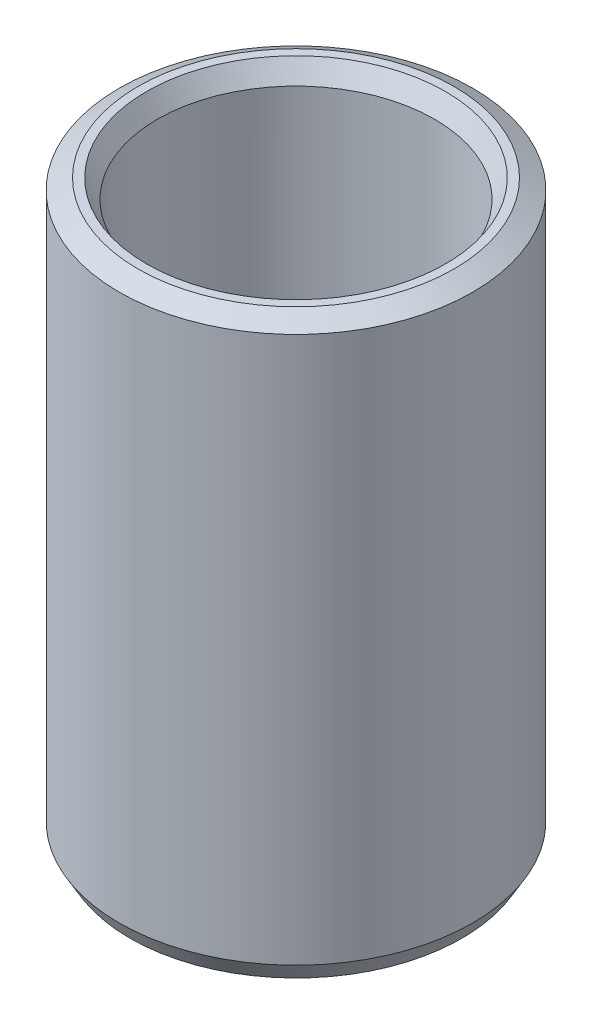
from build123d import *
from OCP.BRepFilletAPI import BRepFilletAPI_MakeChamfer

# Parameters (mm, degrees)
SKETCH1_R           = 45
BOSS_EXTRUDE1_DEPTH = 146.611225133
SKETCH2_R           = 35.304942376
CUT_EXTRUDE1_DEPTH  = 160.827567507
CHAMFER1_SIZE       = 2.74463988
CHAMFER1_SIZE2      = 4.753855721


with BuildPart() as part:
    # Sketch1 → Boss-Extrude1 (new body)
    with BuildSketch(Plane(origin=(0, 0, 0), x_dir=(1, 0, 0), z_dir=(0, 1, 0))):
        Circle(SKETCH1_R)
    extrude(amount=BOSS_EXTRUDE1_DEPTH)

    # Sketch2 → Cut-Extrude1 (cut, through all)
    with BuildSketch(Plane(origin=(0, 0, 0), x_dir=(1, 0, 0), z_dir=(0, 1, 0))):
        Circle(SKETCH2_R)
    extrude(amount=CUT_EXTRUDE1_DEPTH, mode=Mode.SUBTRACT)

    # Chamfer1: one chamfer whose edges measure the first distance from different faces: ONE call of the kernel's chamfer builder (chamfer() names one face for all edges)
    chamfer1_edges_1 = [part.edges().sort_by_distance(p)[0] for p in [
        (-35.304942376, 146.611225133, 0),
    ]]
    chamfer1_side_1 = [part.faces().sort_by_distance(p)[0] for p in [
        (-43.727207794, 146.611225133, 0),
    ]]
    chamfer1_edges_2 = [part.edges().sort_by_distance(p)[0] for p in [
        (-35.304942376, 0, 0),
    ]]
    chamfer1_side_2 = [part.faces().sort_by_distance(p)[0] for p in [
        (-35.304942376, 73.305612567, 0),
    ]]
    chamfer1_edges_3 = [part.edges().sort_by_distance(p)[0] for p in [
        (-45, 0, 0),
    ]]
    chamfer1_side_3 = [part.faces().sort_by_distance(p)[0] for p in [
        (-43.727207794, 0, 0),
    ]]
    chamfer1_edges_4 = [part.edges().sort_by_distance(p)[0] for p in [
        (-45, 146.611225133, 0),
    ]]
    chamfer1_side_4 = [part.faces().sort_by_distance(p)[0] for p in [
        (-45, 73.305612567, 0),
    ]]
    chamfer1 = BRepFilletAPI_MakeChamfer(part.part.solid().wrapped)
    for e in chamfer1_edges_1:
        chamfer1.Add(CHAMFER1_SIZE, CHAMFER1_SIZE2, e.wrapped, chamfer1_side_1[0].wrapped)  # the first distance lies on this face
    for e in chamfer1_edges_2:
        chamfer1.Add(CHAMFER1_SIZE, CHAMFER1_SIZE2, e.wrapped, chamfer1_side_2[0].wrapped)  # the first distance lies on this face
    for e in chamfer1_edges_3:
        chamfer1.Add(CHAMFER1_SIZE, CHAMFER1_SIZE2, e.wrapped, chamfer1_side_3[0].wrapped)  # the first distance lies on this face
    for e in chamfer1_edges_4:
        chamfer1.Add(CHAMFER1_SIZE, CHAMFER1_SIZE2, e.wrapped, chamfer1_side_4[0].wrapped)  # the first distance lies on this face
    add(Compound.cast(chamfer1.Shape()), mode=Mode.REPLACE)


solid = part.part
